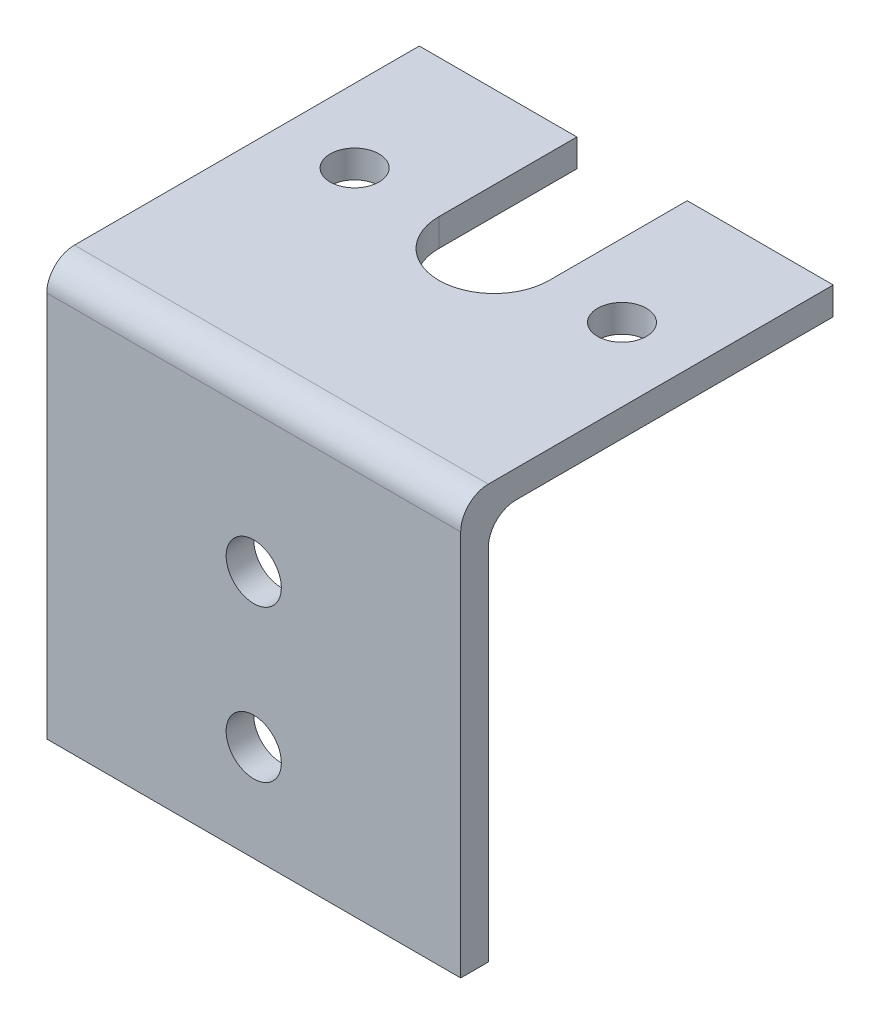
from build123d import *

# Parameters (mm, degrees)
SKETCH1_R           = 2.2479
BOSS_EXTRUDE1_DEPTH = 2.54
FILLET1_R           = 5.08
SKETCH2_W           = 38.1
SKETCH2_H           = 38.1
SKETCH2_R           = 2.54
BOSS_EXTRUDE2_DEPTH = 2.54
FILLET2_R           = 2.54
FILLET3_R           = 2.54


with BuildPart() as part:
    # Sketch1 → Boss-Extrude1 (new body)
    with BuildSketch(Plane(origin=(0, 0, 0), x_dir=(1, 0, 0), z_dir=(0, 1, 0))):
        Polygon((-19.583364039, 16.770768135), (-5.08, 16.770768135), (-5.08, -1.009231865), (5.08, -1.009231865), (5.08, 16.770768135), (18.516635961, 16.770768135), (18.516635961, -14.979231865), (-19.583364039, -14.979231865), align=None)
        with Locations(Location((-12.839664039, 4.070768135, 0), (0, 0, 270))):
            Circle(SKETCH1_R, mode=Mode.SUBTRACT)
        with Locations(Location((11.772935961, 4.070768135, 0), (0, 0, 270))):
            Circle(SKETCH1_R, mode=Mode.SUBTRACT)
    extrude(amount=BOSS_EXTRUDE1_DEPTH)

    # Fillet1
    fillet1_edges = [part.edges().sort_by_distance(p)[0] for p in [
        (5.08, 1.27, 1.009231865),
        (-5.08, 1.27, 1.009231865),
    ]]
    fillet(fillet1_edges, radius=FILLET1_R - 0.0001)  # a hair under: the kernel refuses the full size

    # Sketch2 → Boss-Extrude2 (add)
    with BuildSketch(Plane.XY.offset(14.979231865)):
        with Locations((-0.533364039, -16.51)):
            Rectangle(SKETCH2_W, SKETCH2_H)
        with Locations((-0.533364039, -12.7)):
            Circle(SKETCH2_R, mode=Mode.SUBTRACT)
        with Locations((-0.533364039, -26.67)):
            Circle(SKETCH2_R, mode=Mode.SUBTRACT)
    extrude(amount=BOSS_EXTRUDE2_DEPTH)

    # Fillet2
    fillet2_edges = [part.edges().sort_by_distance(p)[0] for p in [
        (-0.533364039, 0, 14.979231865),
    ]]
    fillet(fillet2_edges, radius=FILLET2_R)

    # Fillet3
    fillet3_edges = [part.edges().sort_by_distance(p)[0] for p in [
        (-0.533364039, 2.54, 17.519231865),
    ]]
    fillet(fillet3_edges, radius=FILLET3_R)


solid = part.part
